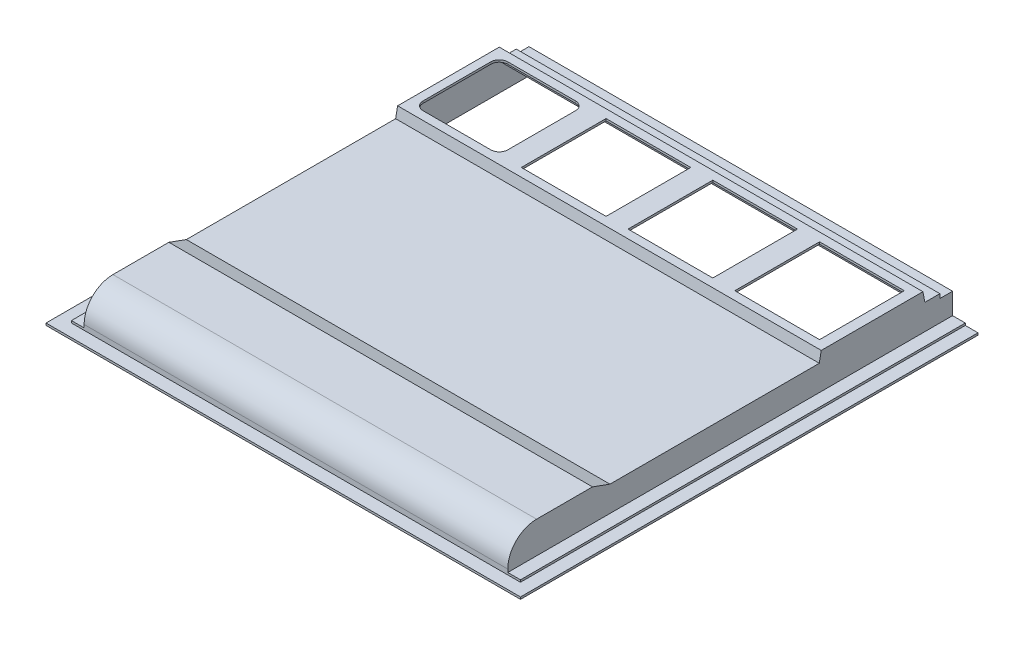
from build123d import *

# Parameters (mm, degrees)
SKETCH1_W               = 711.2
SKETCH1_H               = 685.8
BOSS_EXTRUDE1_DEPTH     = 3.175
SKETCH2_W               = 635
SKETCH2_H               = 666.75
BOSS_EXTRUDE2_DEPTH     = 50.8
CUT_EXTRUDE1_DEPTH      = 497.935680571
CUT_EXTRUDE1_DEPTH_BACK = 497.935680571
SKETCH4_W               = 19.05
SKETCH4_H               = 666.75
BOSS_EXTRUDE3_DEPTH     = 3.175
SKETCH5_W               = 317.5
SKETCH5_H               = 6.35
CUT_EXTRUDE2_DEPTH      = 19.05
FILLET1_R               = 43.18
SKETCH6_W               = 635
SKETCH6_H               = 152.4
BOSS_EXTRUDE4_DEPTH     = 15.24
DRAFT2_ANGLE            = 11
SHELL1_START            = -314.325
SHELL1_DEPTH            = 628.65
SHELL1_START_2          = -333.375
SHELL1_2_OUTLINE_W      = 3.175
SHELL1_2_OUTLINE_H      = 663.575
SHELL1_2_DEPTH          = 666.75
SKETCH7_W               = 127
SKETCH7_H               = 127
CUT_EXTRUDE3_DEPTH      = 25.4
LPATTERN1_COUNT         = 4
LPATTERN1_PITCH         = 160.02
FILLET2_R               = 12.7


# Read off the part's stored shape, not the designer's step: Shell1
with BuildPart() as part:
    # Sketch1 → Boss-Extrude1 (new body)
    with BuildSketch(Plane(origin=(0, 0, 0), x_dir=(1, 0, 0), z_dir=(0, 1, 0))):
        Rectangle(SKETCH1_W, SKETCH1_H)
    extrude(amount=BOSS_EXTRUDE1_DEPTH)

    # Sketch2 → Boss-Extrude2 (add)
    with BuildSketch(Plane(origin=(0, 3.175, 0), x_dir=(1, 0, 0), z_dir=(0, 1, 0))):
        with Locations((0, 9.525)):
            Rectangle(SKETCH2_W, SKETCH2_H)
    extrude(amount=BOSS_EXTRUDE2_DEPTH)

    # Sketch3 → Cut-Extrude1 (cut, two sides: drawn at the far end of the back side and taken through both)
    with BuildSketch(Plane(origin=(0, 0, 0), x_dir=(0, 0, -1), z_dir=(1, 0, 0)).offset(-CUT_EXTRUDE1_DEPTH_BACK)):
        Polygon((-196.85, 53.975), (-170.68027758, 44.45), (342.9, 44.45), (342.9, 53.975), align=None)
    extrude(amount=CUT_EXTRUDE1_DEPTH + CUT_EXTRUDE1_DEPTH_BACK, mode=Mode.SUBTRACT)

    # Sketch4 → Boss-Extrude3 (add)
    with BuildSketch(Plane(origin=(0, 3.175, 0), x_dir=(1, 0, 0), z_dir=(0, 1, 0))):
        with Locations((-327.025, 9.525)):
            Rectangle(SKETCH4_W, SKETCH4_H)
    boss_extrude3 = extrude(amount=BOSS_EXTRUDE3_DEPTH)

    # Mirror1: Boss-Extrude3 across plane
    add(boss_extrude3.mirror(Plane(origin=(0, 0, 0), x_dir=(0, 0, 1), z_dir=(1, 0, 0))))

    # Sketch5 → Cut-Extrude2 (cut)
    with BuildSketch(Plane(origin=(0, 0, -342.9), x_dir=(-1, 0, 0), z_dir=(0, 0, -1))):
        with Locations((-158.75, 41.275)):
            Rectangle(SKETCH5_W, SKETCH5_H)
    cut_extrude2 = extrude(amount=-CUT_EXTRUDE2_DEPTH, mode=Mode.SUBTRACT)

    # Mirror2: Cut-Extrude2 across plane
    add(cut_extrude2.mirror(Plane(origin=(0, 0, 0), x_dir=(0, 0, 1), z_dir=(1, 0, 0))), mode=Mode.SUBTRACT)

    # Fillet1
    fillet1_edges = [part.edges().sort_by_distance(p)[0] for p in [
        (0, 53.975, 323.85),
    ]]
    fillet(fillet1_edges, radius=FILLET1_R)

    # Sketch6 → Boss-Extrude4 (add)
    with BuildSketch(Plane(origin=(0, 44.45, 0), x_dir=(1, 0, 0), z_dir=(0, 1, 0))):
        with Locations((0, 222.25)):
            Rectangle(SKETCH6_W, SKETCH6_H)
    extrude(amount=BOSS_EXTRUDE4_DEPTH)

    # Draft2
    draft2_faces = [part.faces().sort_by_distance(p)[0] for p in [
        (0, 52.07, -146.05),
        (0, 52.07, -298.45),
    ]]
    draft(draft2_faces, Plane.ZX.offset(59.69), DRAFT2_ANGLE)

    # Shell1 outline → Shell1 (cut)
    with BuildSketch(Plane.YZ.offset(SHELL1_START)):
        with BuildLine():
            Line((41.275, -145.704912114), (41.275, 171.240115743))
            Line((41.275, 171.240115743), (50.8, 197.409838164))
            Line((50.8, 197.409838164), (50.8, 280.67))
            ThreePointArc((50.8, 280.67), (39.082806781, 308.957806781), (10.795, 320.675))
            Line((10.795, 320.675), (0, 320.675))
            Line((0, 320.675), (0, -342.9))
            Line((0, -342.9), (34.925, -342.9))
            Line((34.925, -342.9), (34.925, -320.675))
            Line((34.925, -320.675), (41.275, -320.675))
            Line((41.275, -320.675), (41.275, -298.795087886))
            Line((41.275, -298.795087886), (56.515, -295.832731975))
            Line((56.515, -295.832731975), (56.515, -148.667268025))
            Line((56.515, -148.667268025), (41.275, -145.704912114))
        make_face()
    extrude(amount=SHELL1_DEPTH, mode=Mode.SUBTRACT)

    # Shell1 2 outline → Shell1 2 (cut)
    with BuildSketch(Plane.YZ.offset(SHELL1_START_2)):
        with Locations((1.5875, -11.1125)):
            Rectangle(SHELL1_2_OUTLINE_W, SHELL1_2_OUTLINE_H)
    extrude(amount=SHELL1_2_DEPTH, mode=Mode.SUBTRACT)

    # Sketch7 → Cut-Extrude3 (cut)
    with BuildSketch(Plane(origin=(0, 59.69, 0), x_dir=(1, 0, 0), z_dir=(0, 1, 0))):
        with Locations((-241.3, 222.25)):
            Rectangle(SKETCH7_W, SKETCH7_H)
    cut_extrude3 = extrude(amount=-CUT_EXTRUDE3_DEPTH, mode=Mode.SUBTRACT)

    # LPattern1: Cut-Extrude3 ×4
    with Locations(*[(i * LPATTERN1_PITCH, 0, 0) for i in range(1, LPATTERN1_COUNT)]):
        add(cut_extrude3, mode=Mode.SUBTRACT)

    # Fillet2
    fillet2_edges = [part.edges().sort_by_distance(p)[0] for p in [
        (-304.8, 58.1025, -158.75),
        (-304.8, 58.1025, -285.75),
        (-177.8, 58.1025, -285.75),
        (-177.8, 58.1025, -158.75),
    ]]
    fillet(fillet2_edges, radius=FILLET2_R)


solid = part.part
